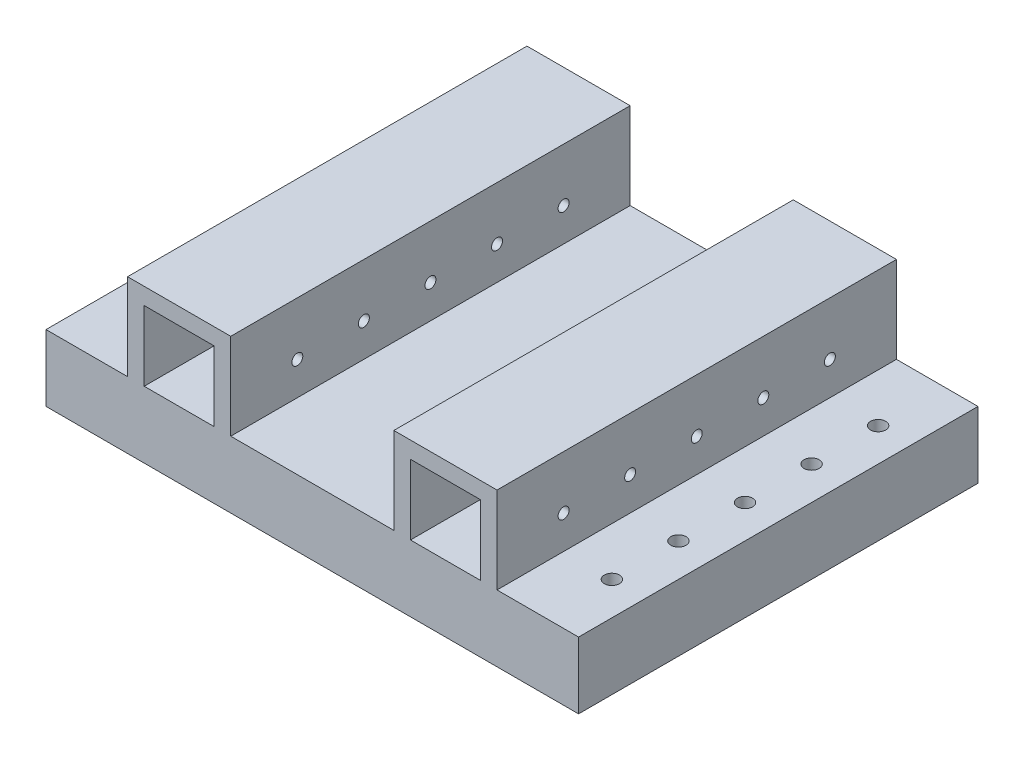
from build123d import *

# Parameters (mm, degrees)
SKETCH_1_W          = 21
SKETCH_1_H          = 21
EXTRUDE_1_DEPTH     = 120
SKETCH_2_W          = 86
SKETCH_2_H          = 75
CUT_EXTRUDE_1_DEPTH = 16
SKETCH_3_R          = 1.65
CUT_EXTRUDE_2_DEPTH = 187.751840687
SKETCH_5_R          = 2.275478237
CUT_EXTRUDE_3_DEPTH = 152.380315761


with BuildPart() as part:
    # 草图1 → 凸台-拉伸1 (new body)
    with BuildSketch(Plane.XY):
        Polygon((-80, 0), (80, 0), (80, 20), (55.5, 20), (55.5, 46), (24.5, 46), (24.5, 20), (-24.5, 20), (-24.5, 46), (-55.5, 46), (-55.5, 20), (-80, 20), align=None)
        with Locations((40, 30.5)):
            Rectangle(SKETCH_1_W, SKETCH_1_H, mode=Mode.SUBTRACT)
        with Locations((-40, 30.5)):
            Rectangle(SKETCH_1_W, SKETCH_1_H, mode=Mode.SUBTRACT)
    extrude(amount=EXTRUDE_1_DEPTH)

    # 草图2 → 切除-拉伸1 (cut)
    with BuildSketch(Plane.XZ):
        with Locations((0, 60)):
            Rectangle(SKETCH_2_W, SKETCH_2_H)
    extrude(amount=-CUT_EXTRUDE_1_DEPTH, mode=Mode.SUBTRACT)

    # 草图3 → 切除-拉伸2 (cut, through all)
    with BuildSketch(Plane.ZY.offset(55.5)):
        with Locations((20, 30)):
            Circle(SKETCH_3_R)
        with Locations((40, 30)):
            Circle(SKETCH_3_R)
        with Locations((60, 30)):
            Circle(SKETCH_3_R)
        with Locations((80, 30)):
            Circle(SKETCH_3_R)
        with Locations((100, 30)):
            Circle(SKETCH_3_R)
    extrude(amount=-CUT_EXTRUDE_2_DEPTH, mode=Mode.SUBTRACT)

    # 草图5 → 切除-拉伸3 (cut, through all)
    with BuildSketch(Plane.XZ):
        with Locations((-70, 100)):
            Circle(SKETCH_5_R)
        with Locations((-70, 80)):
            Circle(SKETCH_5_R)
        with Locations((-70, 60)):
            Circle(SKETCH_5_R)
        with Locations((-70, 40)):
            Circle(SKETCH_5_R)
        with Locations((-70, 20)):
            Circle(SKETCH_5_R)
    cut_extrude_3 = extrude(amount=-CUT_EXTRUDE_3_DEPTH, mode=Mode.SUBTRACT)

    # 镜向1: 切除-拉伸3 across plane
    add(cut_extrude_3.mirror(Plane(origin=(0, 0, 0), x_dir=(0, 0, 1), z_dir=(1, 0, 0))), mode=Mode.SUBTRACT)


solid = part.part
